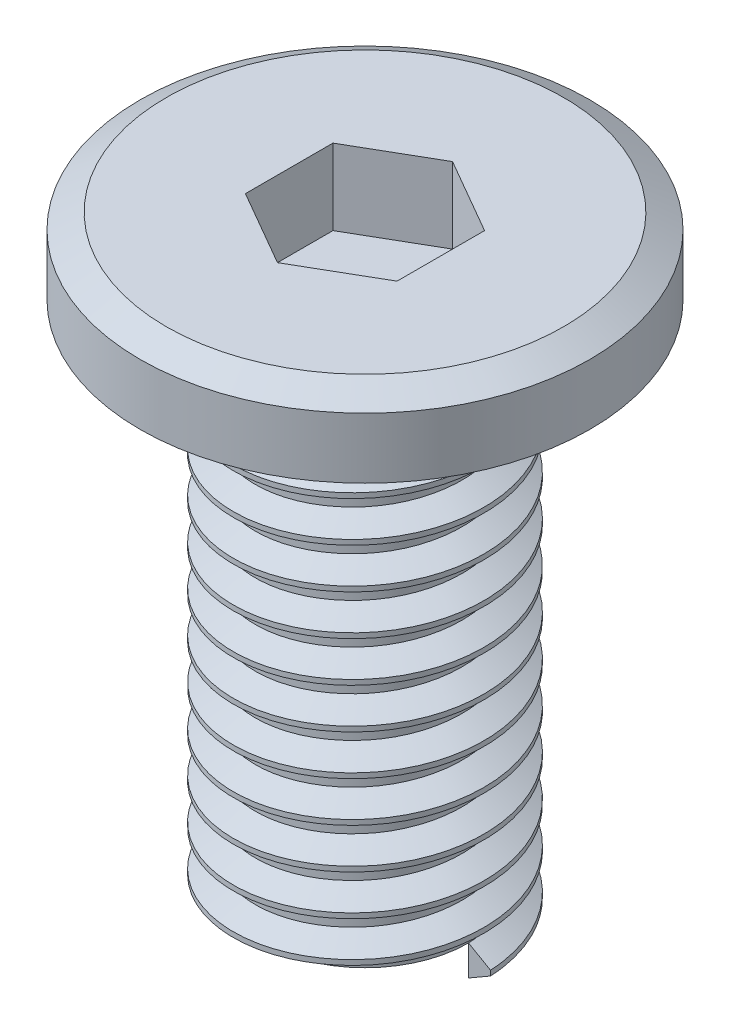
from build123d import *
from build123d.topology import SkipClean

# Parameters (mm, degrees)
SKETCH1_R           = 4.45
BOSS_EXTRUDE1_DEPTH = 1.5
CHAMFER2_SIZE       = 0.3
CHAMFER2_SIZE2      = 0.519615242
CUT_EXTRUDE1_DEPTH  = 3
SKETCH3_R           = 2.05
BOSS_EXTRUDE2_DEPTH = 10
THREAD1_PITCH       = 0.8


with BuildPart() as part:
    # Sketch1 → Boss-Extrude1 (new body)
    with BuildSketch(Plane(origin=(0, 0, 0), x_dir=(1, 0, 0), z_dir=(0, 1, 0))):
        with Locations(Location((0, 0, 0), (0, 0, 270))):
            Circle(SKETCH1_R)
    extrude(amount=BOSS_EXTRUDE1_DEPTH)

    # Chamfer2
    chamfer2_edges = [part.edges().sort_by_distance(p)[0] for p in [
        (0, 1.5, -4.45),
    ]]
    chamfer2_side = [part.faces().sort_by_distance(p)[0] for p in [
        (0, 0.75, -4.45),
    ]]
    chamfer(chamfer2_edges, length=CHAMFER2_SIZE, length2=CHAMFER2_SIZE2, reference=chamfer2_side[0])

    # Sketch8 → Cut-Extrude1 (cut)
    with BuildSketch(Plane(origin=(0, 1.5, 0), x_dir=(1, 0, 0), z_dir=(0, 1, 0))):
        Polygon((0, 1.732050808), (-1.5, 0.866025404), (-1.5, -0.866025404), (0, -1.732050808), (1.5, -0.866025404), (1.5, 0.866025404), align=None)
    extrude(amount=-CUT_EXTRUDE1_DEPTH, mode=Mode.SUBTRACT)

    # Sketch3 → Boss-Extrude2 (add)
    with BuildSketch(Plane.XZ):
        with Locations(Location((0, 0, 0), (0, 0, 90))):
            Circle(SKETCH3_R)
    extrude(amount=BOSS_EXTRUDE2_DEPTH)

    # Thread1: the profile of Thread Profile2 profile screwed along a right-hand helix of 12.5 turns, 8 arcs to a turn; built about Z, then put on its axis
    with SkipClean():  # the faces are left unmerged after this step: merging them gives an invalid solid
        thread1_z = Axis((0, 0, 0), (0, 0, 1))
        thread1_corners = [(2.0497, 0, -0.000173205), (2.4830127, 0, 0.249999999), (2.4830127, 0, 0.349999999), (2.0497, 0, 0.600173203)]
        with BuildLine(mode=Mode.PRIVATE) as thread1_profile:
            Line(thread1_corners[0], thread1_corners[1])
            Line(thread1_corners[1], thread1_corners[2])
            Line(thread1_corners[2], thread1_corners[3])
            Line(thread1_corners[3], thread1_corners[0])
        thread1_cap = Face(thread1_profile.wire())
        thread1_turn_angles = [0, 22.5, 45, 67.5, 90, 112.5, 135, 157.5, 180, 202.5, 225, 247.5, 270, 292.5, 315, 337.5, 360]
        thread1_turn_weights = [1, 0.9238795325112867, 1, 0.9238795325112867, 1, 0.9238795325112867, 1, 0.9238795325112867, 1, 0.9238795325112867, 1, 0.9238795325112867, 1, 0.9238795325112867, 1, 0.9238795325112867, 1]
        thread1_turn_rails = [Edge.make_bspline([Vector(p[0], p[1], 0).rotate(thread1_z, thread1_turn_angles[k]) / thread1_turn_weights[k] + Vector(0, 0, p[2] + THREAD1_PITCH * thread1_turn_angles[k] / 360) for k in range(17)], [0, 0, 0, 1, 1, 2, 2, 3, 3, 4, 4, 5, 5, 6, 6, 7, 7, 8, 8, 8], 2, thread1_turn_weights) for p in thread1_corners]
        thread1_turn_sides = [Face.make_surface_from_curves(thread1_turn_rails[p[0]], thread1_turn_rails[p[1]]) for p in [(0, 1), (1, 2), (2, 3), (3, 0)]]
        thread1_last_angles = [4320, 4342.5, 4365, 4387.5, 4410, 4432.5, 4455, 4477.5, 4500]
        thread1_last_weights = [1, 0.9238795325112867, 1, 0.9238795325112867, 1, 0.9238795325112867, 1, 0.9238795325112867, 1]
        thread1_last_rails = [Edge.make_bspline([Vector(p[0], p[1], 0).rotate(thread1_z, thread1_last_angles[k]) / thread1_last_weights[k] + Vector(0, 0, p[2] + THREAD1_PITCH * thread1_last_angles[k] / 360) for k in range(9)], [0, 0, 0, 1, 1, 2, 2, 3, 3, 4, 4, 4], 2, thread1_last_weights) for p in thread1_corners]
        thread1_last_sides = [Face.make_surface_from_curves(thread1_last_rails[p[0]], thread1_last_rails[p[1]]) for p in [(0, 1), (1, 2), (2, 3), (3, 0)]]
        thread1 = Plane(origin=(0, 0, 0), x_dir=(-1, 0, 0), z_dir=(0, -1, 0)) * Solid(Shell([*[p.moved(Location((0, 0, THREAD1_PITCH * i))) for i in range(12) for p in thread1_turn_sides], *thread1_last_sides, thread1_cap, thread1_cap.rotate(thread1_z, 4500).moved(Location((0, 0, THREAD1_PITCH * 4500 / 360)))]))
        add(thread1)


solid = part.part
